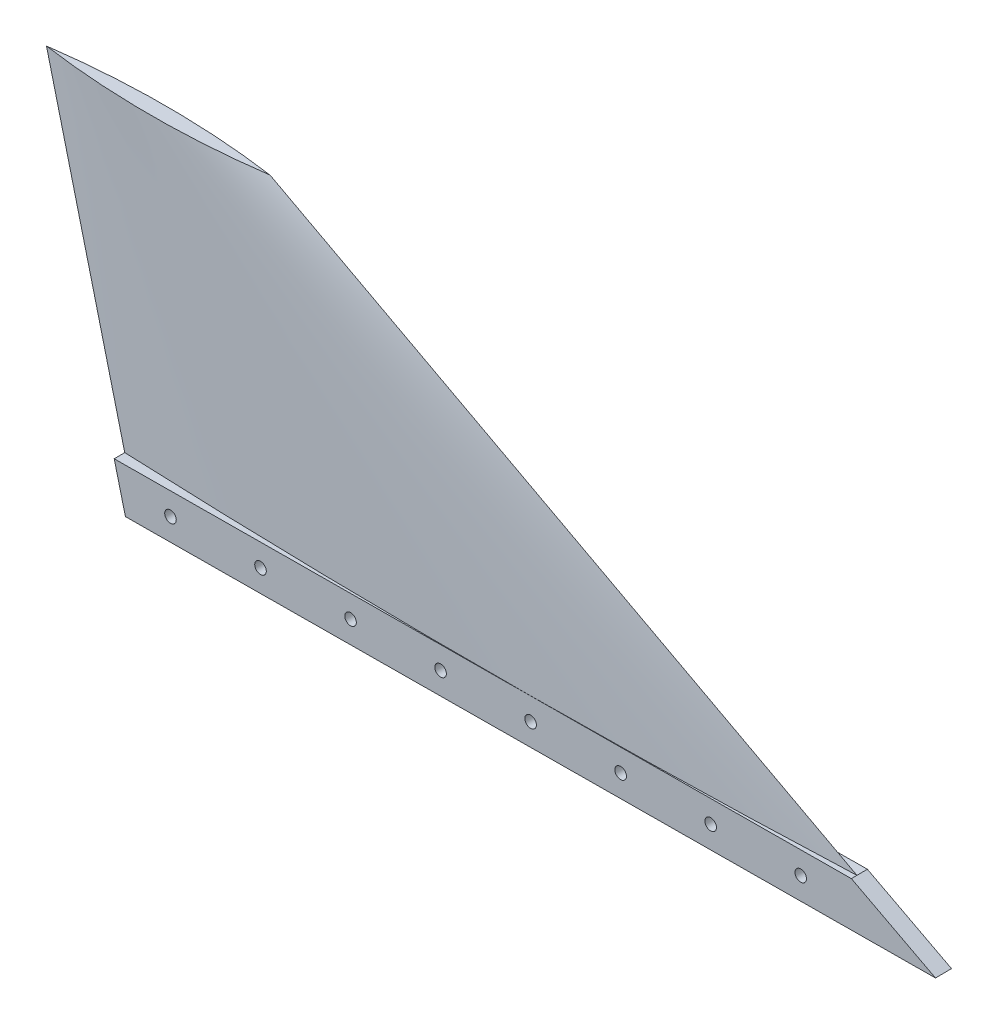
from build123d import *

# Parameters (mm, degrees)
BOSS_EXTRUDE1_DEPTH     = 9.162180558
CUT_EXTRUDE1_DEPTH      = 501.37942121
CUT_EXTRUDE1_DEPTH_BACK = 501.37942121
SKETCH12_W              = 6.35
SKETCH12_H              = 25.4
F_1_4_CLEARANCE_HOLE1_D = 6.5278
LPATTERN1_COUNT         = 8
LPATTERN1_PITCH         = 50.8
SKETCH14_W              = 457.208458034
SKETCH14_H              = 25.4
CUT_EXTRUDE2_DEPTH      = 501.453155036


with BuildPart() as part:
    # Sketch5 for Loft4 → Loft4 section 0
    with BuildSketch(Plane(origin=(0, 203.2, 0), x_dir=(1, 0, 0), z_dir=(0, 1, 0))):
        with BuildLine():
            # circular arc as an exact rational Bezier (weights 1, cos(half-angle), 1)
            Bezier((-50.8, 0), (12.7, 8.9337755), (76.2, 0), weights=[1, 0.990247786, 1])
            Bezier((76.2, 0), (12.7, -8.9337755), (-50.8, 0), weights=[1, 0.990247786, 1])
        make_face()
    # Sketch1 for Loft4 → Loft4 section 1
    with BuildSketch(Plane(origin=(0, 0, 0), x_dir=(1, 0, 0), z_dir=(0, 1, 0))):
        with BuildLine():
            Bezier((0, 0), (228.6, 8.89336246), (457.2, 0), weights=[1, 0.999244113, 1])
            Bezier((457.2, 0), (228.6, -8.89336246), (0, 0), weights=[1, 0.999244113, 1])
        make_face()
    loft()

    # Sketch10 → Boss-Extrude1 (add)
    with BuildSketch(Plane(origin=(-0.021680451, 0, -3.185074689), x_dir=(0, -1, 0), z_dir=(0.006806731520561807, 0, 0.9999768339346702))):
        Polygon((0, 457.189408475), (0, 0), (-25.4, -6.349852895), (-25.4, 409.565511759), align=None)
    extrude(amount=BOSS_EXTRUDE1_DEPTH)

    # Sketch12 → Cut-Extrude1 (cut, two sides: drawn at the far end of the back side and taken through both)
    with BuildSketch(Plane(origin=(0, 0, 0), x_dir=(0.006806731520561807, 0, 0.9999768339346702), z_dir=(-0.9999768339346702, 0, 0.006806731520561807)).offset(-CUT_EXTRUDE1_DEPTH_BACK)):
        with Locations((9.152032082, 12.7)):
            Rectangle(SKETCH12_W, SKETCH12_H)
        with Locations((-6.360148476, 12.7)):
            Rectangle(SKETCH12_W, SKETCH12_H)
    extrude(amount=CUT_EXTRUDE1_DEPTH + CUT_EXTRUDE1_DEPTH_BACK, mode=Mode.SUBTRACT)

    # 1/4 Clearance Hole1 (through all)
    with Locations(Plane(origin=(0.097036893, 0, 14.25568857), x_dir=(0, -1, 0), z_dir=(0.006806731520561807, 0, 0.9999768339346702))):
        with Locations((-12.7, 25.4)):
            f_1_4_clearance_hole1 = Hole(F_1_4_CLEARANCE_HOLE1_D / 2)

    # LPattern1: 1/4 Clearance Hole1 ×8
    with Locations(*[(i * LPATTERN1_PITCH, 0, 0) for i in range(1, LPATTERN1_COUNT)]):
        add(f_1_4_clearance_hole1, mode=Mode.SUBTRACT)

    # Sketch14 → Cut-Extrude2 (cut, through all)
    with BuildSketch(Plane(origin=(0.040684053, 0, 5.976893617), x_dir=(0.9999768339346702, 0, -0.006806731520561792), z_dir=(0.006806731520561792, 0, 0.9999768339346703))):
        with Locations((228.585179458, -12.6238)):
            Rectangle(SKETCH14_W, SKETCH14_H)
    extrude(amount=-CUT_EXTRUDE2_DEPTH, mode=Mode.SUBTRACT)


solid = part.part
